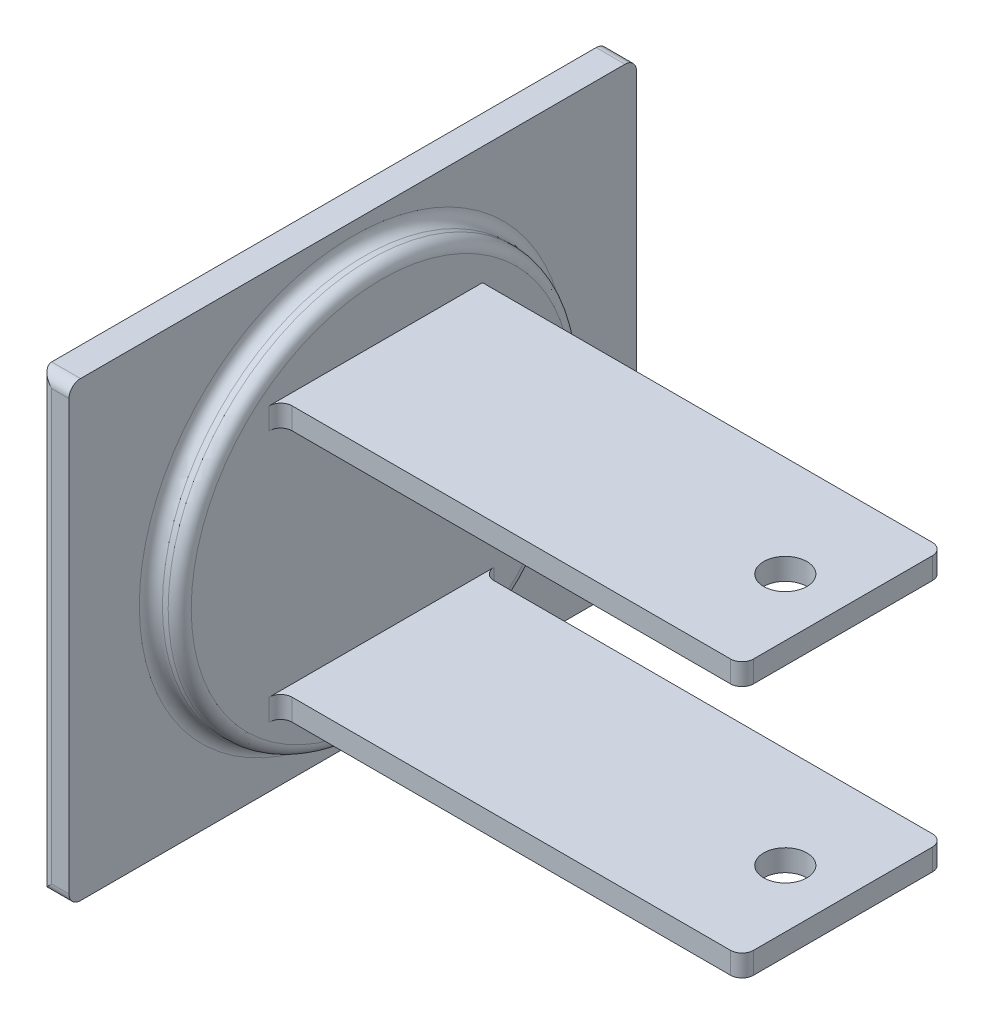
from build123d import *

# Parameters (mm, degrees)
SKETCH1_W           = 124.968
SKETCH1_H           = 99.568
BOSS_EXTRUDE1_DEPTH = 6.35
SKETCH2_R           = 44.45
BOSS_EXTRUDE2_DEPTH = 6.35
SKETCH3_W           = 44.45
SKETCH3_H           = 4.7625
BOSS_EXTRUDE3_DEPTH = 101.6
SKETCH4_R           = 4.7625
CUT_EXTRUDE1_DEPTH  = 188.277691908
FILLET1_R           = 2.54


with BuildPart() as part:
    # Sketch1 → Boss-Extrude1 (new body)
    with BuildSketch(Plane(origin=(0, 0, 0), x_dir=(0, 0, -1), z_dir=(1, 0, 0))):
        with Locations((62.484, 49.784)):
            Rectangle(SKETCH1_W, SKETCH1_H)
    extrude(amount=BOSS_EXTRUDE1_DEPTH)

    # Sketch2 → Boss-Extrude2 (add)
    with BuildSketch(Plane(origin=(6.35, 0, 0), x_dir=(0, 0, -1), z_dir=(1, 0, 0))):
        with Locations((62.484, 49.784)):
            Circle(SKETCH2_R)
    extrude(amount=BOSS_EXTRUDE2_DEPTH)

    # Sketch3 → Boss-Extrude3 (add)
    with BuildSketch(Plane(origin=(12.7, 0, 0), x_dir=(0, 0, -1), z_dir=(1, 0, 0))):
        with Locations((62.484, 77.56525)):
            Rectangle(SKETCH3_W, SKETCH3_H)
        with Locations((62.484, 22.00275)):
            Rectangle(SKETCH3_W, SKETCH3_H)
    extrude(amount=BOSS_EXTRUDE3_DEPTH)

    # Sketch4 → Cut-Extrude1 (cut, through all)
    with BuildSketch(Plane.XZ.offset(-19.6215)):
        with Locations((101.6, -62.484)):
            Circle(SKETCH4_R)
    extrude(amount=-CUT_EXTRUDE1_DEPTH, mode=Mode.SUBTRACT)

    # Fillet1
    fillet1_edges = [part.edges().sort_by_distance(p)[0] for p in [
        (6.35, 49.784, -18.034),
        (0, 49.784, 0),
        (12.7, 49.784, -18.034),
        (12.7, 22.00275, -84.709),
        (12.7, 22.00275, -40.259),
        (12.7, 77.56525, -40.259),
        (114.3, 77.56525, -40.259),
        (114.3, 22.00275, -40.259),
        (114.3, 22.00275, -84.709),
        (3.175, 0, 0),
        (114.3, 77.56525, -84.709),
        (3.175, 0, -124.968),
        (3.175, 99.568, 0),
        (3.175, 99.568, -124.968),
    ]]
    fillet(fillet1_edges, radius=FILLET1_R)


solid = part.part
